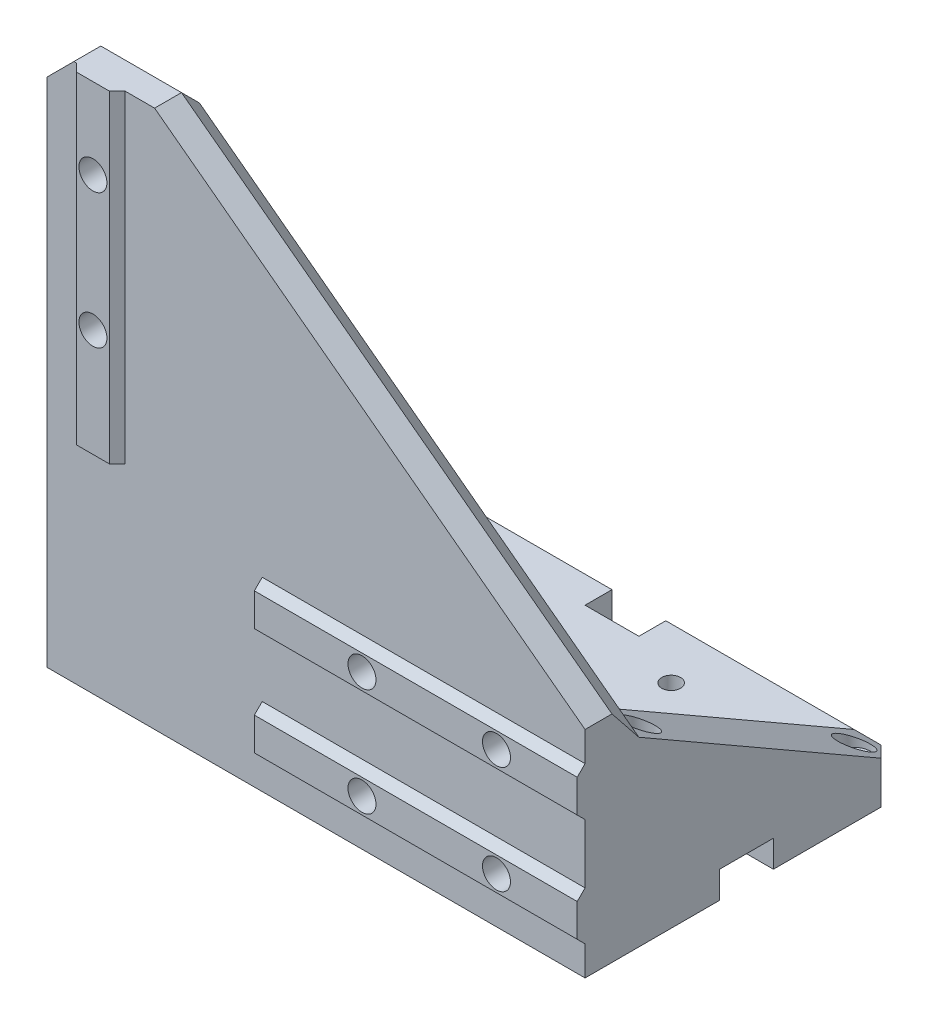
from build123d import *

# Parameters (mm, degrees)
BOSS_EXTRUDE1_DEPTH     = 10
SKETCH2_R               = 2.6
CUT_EXTRUDE1_DEPTH      = 142.774468788
BOSS_EXTRUDE3_START     = 10
SKETCH3_W               = 60
SKETCH3_H               = 9
SKETCH3_W_2             = 9
SKETCH3_H_2             = 60
BOSS_EXTRUDE3_DEPTH     = 1.46
CUT_EXTRUDE2_DEPTH      = 142.884923794
CUT_EXTRUDE2_DEPTH_BACK = 142.884923794
SKETCH2_2_R             = 2.6
CHAMFER1_SIZE           = 1.46
SKETCH4_R               = 4.5
CUT_EXTRUDE3_DEPTH      = 5
SKETCH5_W               = 100
SKETCH5_H               = 50
SKETCH5_R               = 11.5
SKETCH5_R_2             = 1.75
BOSS_EXTRUDE4_DEPTH     = 5
BOSS_EXTRUDE5_DEPTH     = 10
BOSS_EXTRUDE6_START     = 100
BOSS_EXTRUDE6_DEPTH     = 10
CUT_EXTRUDE4_DEPTH      = 151
CUT_EXTRUDE4_DEPTH_BACK = 151
SKETCH9_R               = 1.75
CUT_EXTRUDE5_START      = 100
SKETCH11_R              = 3
CUT_EXTRUDE5_DEPTH      = 95
SKETCH12_W              = 5
SKETCH12_H              = 10
SKETCH12_W_2            = 10
SKETCH12_H_2            = 5
CUT_EXTRUDE6_DEPTH      = 5
CHAMFER2_SIZE           = 5


with BuildPart() as part:
    # Sketch1 → Boss-Extrude1 (new body)
    with BuildSketch(Plane.XY):
        Polygon((0, 0), (100, 0), (100, 40), (20, 100), (0, 100), align=None)
    extrude(amount=BOSS_EXTRUDE1_DEPTH)

    # Sketch2 → Cut-Extrude1 (cut, through all)
    with BuildSketch(Plane.XY):
        with Locations((10, 85)):
            Circle(SKETCH2_R)
        with Locations((10, 60)):
            Circle(SKETCH2_R)
        with Locations((85, 30)):
            Circle(SKETCH2_R)
        with Locations((85, 10)):
            Circle(SKETCH2_R)
        with Locations((60, 10)):
            Circle(SKETCH2_R)
        with Locations((60, 30)):
            Circle(SKETCH2_R)
    extrude(amount=CUT_EXTRUDE1_DEPTH, mode=Mode.SUBTRACT)

    # Sketch3 → Boss-Extrude3 (add)
    with BuildSketch(Plane.XY.offset(BOSS_EXTRUDE3_START)):
        with Locations((70, 30)):
            Rectangle(SKETCH3_W, SKETCH3_H)
        with Locations((70, 10)):
            Rectangle(SKETCH3_W, SKETCH3_H)
        with Locations((10, 70)):
            Rectangle(SKETCH3_W_2, SKETCH3_H_2)
    extrude(amount=BOSS_EXTRUDE3_DEPTH)

    # Sketch2<2> → Cut-Extrude2 (cut, two sides: drawn at the far end of the back side and taken through both)
    with BuildSketch(Plane.XY.offset(-CUT_EXTRUDE2_DEPTH_BACK)):
        with Locations((10, 85)):
            Circle(SKETCH2_2_R)
        with Locations((10, 60)):
            Circle(SKETCH2_2_R)
        with Locations((85, 30)):
            Circle(SKETCH2_2_R)
        with Locations((85, 10)):
            Circle(SKETCH2_2_R)
        with Locations((60, 10)):
            Circle(SKETCH2_2_R)
        with Locations((60, 30)):
            Circle(SKETCH2_2_R)
    extrude(amount=CUT_EXTRUDE2_DEPTH + CUT_EXTRUDE2_DEPTH_BACK, mode=Mode.SUBTRACT)

    # Chamfer1
    chamfer1_edges = [part.edges().sort_by_distance(p)[0] for p in [
        (14.5, 70, 11.46),
        (5.5, 70, 11.46),
        (70, 5.5, 11.46),
        (70, 14.5, 11.46),
        (70, 25.5, 11.46),
        (70, 34.5, 11.46),
    ]]
    chamfer(chamfer1_edges, length=CHAMFER1_SIZE - 0.0001)  # a hair under: the kernel refuses the full size

    # Sketch4 → Cut-Extrude3 (cut)
    with BuildSketch(Plane.XY):
        with Locations((10, 85)):
            Circle(SKETCH4_R)
        with Locations((10, 60)):
            Circle(SKETCH4_R)
        with Locations((60, 30)):
            Circle(SKETCH4_R)
        with Locations((85, 30)):
            Circle(SKETCH4_R)
        with Locations((85, 10)):
            Circle(SKETCH4_R)
        with Locations((60, 10)):
            Circle(SKETCH4_R)
    extrude(amount=CUT_EXTRUDE3_DEPTH, mode=Mode.SUBTRACT)

    # Sketch5 → Boss-Extrude4 (add)
    with BuildSketch(Plane(origin=(0, 0, 0), x_dir=(1, 0, 0), z_dir=(0, 1, 0))):
        with Locations((50, 25)):
            Rectangle(SKETCH5_W, SKETCH5_H)
        with Locations(Location((50, 25, 0), (0, 0, 270))):
            Circle(SKETCH5_R, mode=Mode.SUBTRACT)
        with Locations(Location((65.5, 9.5, 0), (0, 0, 270))):
            Circle(SKETCH5_R_2, mode=Mode.SUBTRACT)
        with Locations(Location((34.5, 9.5, 0), (0, 0, 270))):
            Circle(SKETCH5_R_2, mode=Mode.SUBTRACT)
        with Locations(Location((34.5, 40.5, 0), (0, 0, 270))):
            Circle(SKETCH5_R_2, mode=Mode.SUBTRACT)
        with Locations(Location((65.5, 40.5, 0), (0, 0, 270))):
            Circle(SKETCH5_R_2, mode=Mode.SUBTRACT)
    extrude(amount=BOSS_EXTRUDE4_DEPTH)

    # Sketch8 → Boss-Extrude5 (add)
    with BuildSketch(Plane(origin=(0, 0, 0), x_dir=(0, 0, -1), z_dir=(1, 0, 0))):
        Polygon((0, 5), (50, 5), (0, 33.75), align=None)
    extrude(amount=BOSS_EXTRUDE5_DEPTH)

    # Sketch8<2> → Boss-Extrude6 (add)
    with BuildSketch(Plane(origin=(0, 0, 0), x_dir=(0, 0, -1), z_dir=(1, 0, 0)).offset(BOSS_EXTRUDE6_START)):
        Polygon((0, 5), (50, 5), (0, 33.75), align=None)
    extrude(amount=-BOSS_EXTRUDE6_DEPTH)

    # Sketch9 → Cut-Extrude4 (cut, two sides: drawn at the far end of the back side and taken through both)
    with BuildSketch(Plane(origin=(0, 0, 0), x_dir=(1, 0, 0), z_dir=(0, 1, 0)).offset(-CUT_EXTRUDE4_DEPTH_BACK)):
        with Locations(Location((95, 45, 0), (0, 0, 90))):
            Circle(SKETCH9_R)
        with Locations(Location((5, 45, 0), (0, 0, 90))):
            Circle(SKETCH9_R)
        with Locations(Location((5, 5, 0), (0, 0, 90))):
            Circle(SKETCH9_R)
        with Locations(Location((95, 5, 0), (0, 0, 90))):
            Circle(SKETCH9_R)
    extrude(amount=CUT_EXTRUDE4_DEPTH + CUT_EXTRUDE4_DEPTH_BACK, mode=Mode.SUBTRACT)

    # Sketch11 → Cut-Extrude5 (cut)
    with BuildSketch(Plane(origin=(0, 0, 0), x_dir=(1, 0, 0), z_dir=(0, 1, 0)).offset(CUT_EXTRUDE5_START)):
        with Locations(Location((95, 5, 0), (0, 0, 270))):
            Circle(SKETCH11_R)
        with Locations(Location((95, 45, 0), (0, 0, 270))):
            Circle(SKETCH11_R)
        with Locations(Location((5, 5, 0), (0, 0, 270))):
            Circle(SKETCH11_R)
        with Locations(Location((5, 45, 0), (0, 0, 270))):
            Circle(SKETCH11_R)
    extrude(amount=-CUT_EXTRUDE5_DEPTH, mode=Mode.SUBTRACT)

    # Sketch12 → Cut-Extrude6 (cut)
    with BuildSketch(Plane(origin=(0, 0, 0), x_dir=(1, 0, 0), z_dir=(0, 1, 0))):
        with Locations((97.5, 20)):
            Rectangle(SKETCH12_W, SKETCH12_H)
        with Locations((2.5, 20)):
            Rectangle(SKETCH12_W, SKETCH12_H)
        with Locations((50, 47.5)):
            Rectangle(SKETCH12_W_2, SKETCH12_H_2)
    extrude(amount=CUT_EXTRUDE6_DEPTH, mode=Mode.SUBTRACT)

    # Chamfer2
    chamfer2_edges = [part.edges().sort_by_distance(p)[0] for p in [
        (100, 2.5, -50),
        (0, 2.5, -50),
        (60, 70, 0),
        (0, 100, 5),
        (10, 100, 0),
        (0, 66.875, 0),
    ]]
    chamfer(chamfer2_edges, length=CHAMFER2_SIZE)


solid = part.part
